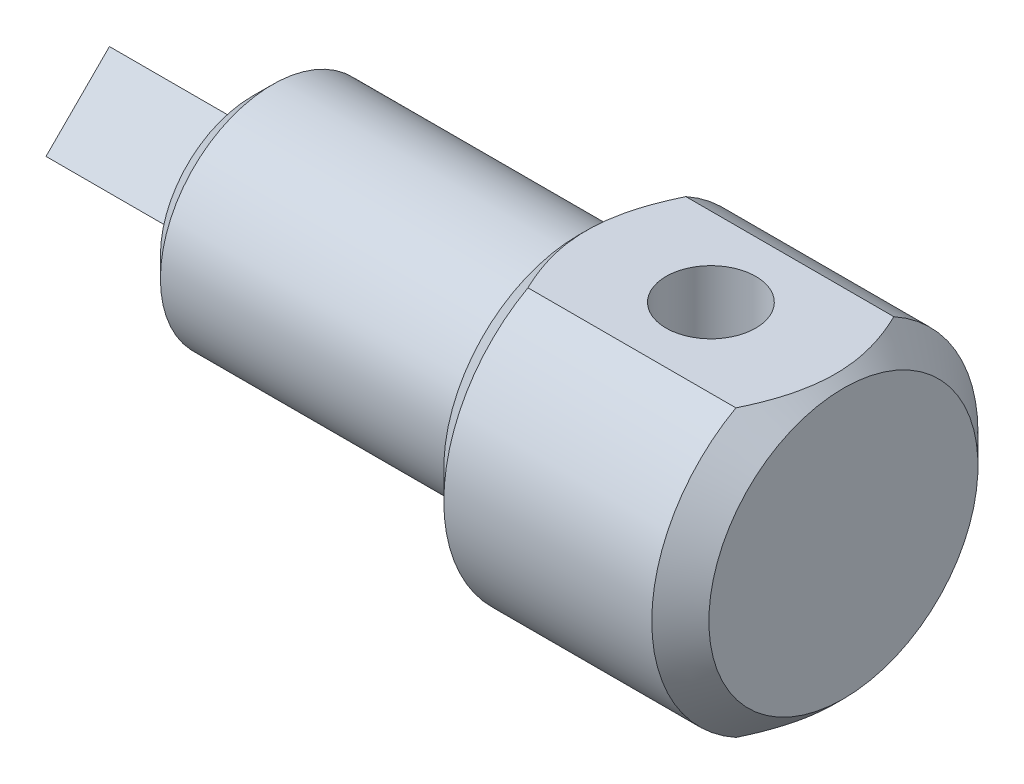
from build123d import *

# Parameters (mm, degrees)
EXTRUDE_1_DEPTH          = 35
SKETCH_4_W               = 45.00000000000001
SKETCH_4_H               = 5
CUT_EXTRUDE_1_DEPTH      = 8
CUT_EXTRUDE_2_DEPTH      = 189.67962264113208
CUT_EXTRUDE_3_DEPTH      = 166.90660023037057
CUT_EXTRUDE_3_DEPTH_BACK = 166.90660023037057
SKETCH_6_R               = 10.999999999999993
CHAMFER_1_SIZE           = 7
CHAMFER_2_SIZE           = 5


with BuildPart() as part:
    # Эскиз1 → Повернуть1 (revolve)
    with BuildSketch(Plane.XY, mode=Mode.PRIVATE) as revolve_1_sk:
        Polygon((0, 0), (0, 27.5), (80, 27.500000000000004), (80, 40.00000000000001), (145, 40.00000000000001), (145, 1e-17), align=None)
    revolve(revolve_1_sk.sketch.rotate(Axis((0, 0, 0), (-1, 0, 0)), 90), axis=Axis((0, 0, 0), (-1, 0, 0)))

    # Эскиз3 → Бобышка-Вытянуть1 (add)
    with BuildSketch(Plane.ZY):
        Polygon((-1.63e-15, -15.556349186104034), (-15.556349186104049, 8.31e-15), (-6.49e-15, 15.55634918610405), (15.55634918610404, 8.54e-15), align=None)
    extrude(amount=EXTRUDE_1_DEPTH)

    # Эскиз4 → Вырез-Вытянуть1 (cut, symmetric)
    with BuildSketch(Plane(origin=(0, 0, 0), x_dir=(1, 0, 0), z_dir=(0, 1, 0))):
        with Locations((37.50000000000001, 25.000000000000004)):
            Rectangle(SKETCH_4_W, SKETCH_4_H)
    extrude(amount=CUT_EXTRUDE_1_DEPTH, both=True, mode=Mode.SUBTRACT)

    # Эскиз5 → Вырез-Вытянуть2 (cut, symmetric)
    with BuildSketch(Plane(origin=(145, 0, 0), x_dir=(0, 0, -1), z_dir=(1, 0, 0))):
        Polygon((-220.66774826766613, 35), (-19.364916731037095, 35), (19.364916731037095, 35), (220.66774826766613, 35), (220.66774826766613, 437.6056630732581), (-220.66774826766613, 437.6056630732581), align=None)
    cut_extrude_2 = extrude(amount=CUT_EXTRUDE_2_DEPTH, both=True, mode=Mode.SUBTRACT)

    # Зеркальное отражение1: Вырез-Вытянуть2 across plane
    add(cut_extrude_2.mirror(Plane.ZX), mode=Mode.SUBTRACT)

    # Эскиз6 → Вырез-Вытянуть3 (cut, two sides: drawn at the far end of the back side and taken through both)
    with BuildSketch(Plane(origin=(0, 35, 0), x_dir=(1, 0, 0), z_dir=(0, 1, 0)).offset(-CUT_EXTRUDE_3_DEPTH_BACK)):
        with Locations(Location((112.5, 0, 0), (0, 0, 270))):
            Circle(SKETCH_6_R)
    extrude(amount=CUT_EXTRUDE_3_DEPTH + CUT_EXTRUDE_3_DEPTH_BACK, mode=Mode.SUBTRACT)

    # Фаска1
    chamfer_1_edges = [part.edges().sort_by_distance(p)[0] for p in [
        (80, 3.55e-15, -40.00000000000001),
    ]]
    chamfer(chamfer_1_edges, length=CHAMFER_1_SIZE)
    chamfer_1_2_edges = [part.edges().sort_by_distance(p)[0] for p in [
        (80, -1.421e-14, 40.000000000000014),
    ]]
    chamfer(chamfer_1_2_edges, length=CHAMFER_1_SIZE - 0.0001)  # a hair under: the kernel refuses the full size
    chamfer_1_3_edges = [part.edges().sort_by_distance(p)[0] for p in [
        (145, 3.55e-15, -40.00000000000001),
    ]]
    chamfer(chamfer_1_3_edges, length=CHAMFER_1_SIZE)
    chamfer_1_4_edges = [part.edges().sort_by_distance(p)[0] for p in [
        (145, -1.421e-14, 40.000000000000014),
    ]]
    chamfer(chamfer_1_4_edges, length=CHAMFER_1_SIZE - 0.0001)  # a hair under: the kernel refuses the full size

    # Фаска2
    chamfer_2_edges = [part.edges().sort_by_distance(p)[0] for p in [
        (0, -6.42e-15, 27.5),
    ]]
    chamfer(chamfer_2_edges, length=CHAMFER_2_SIZE)


solid = part.part
